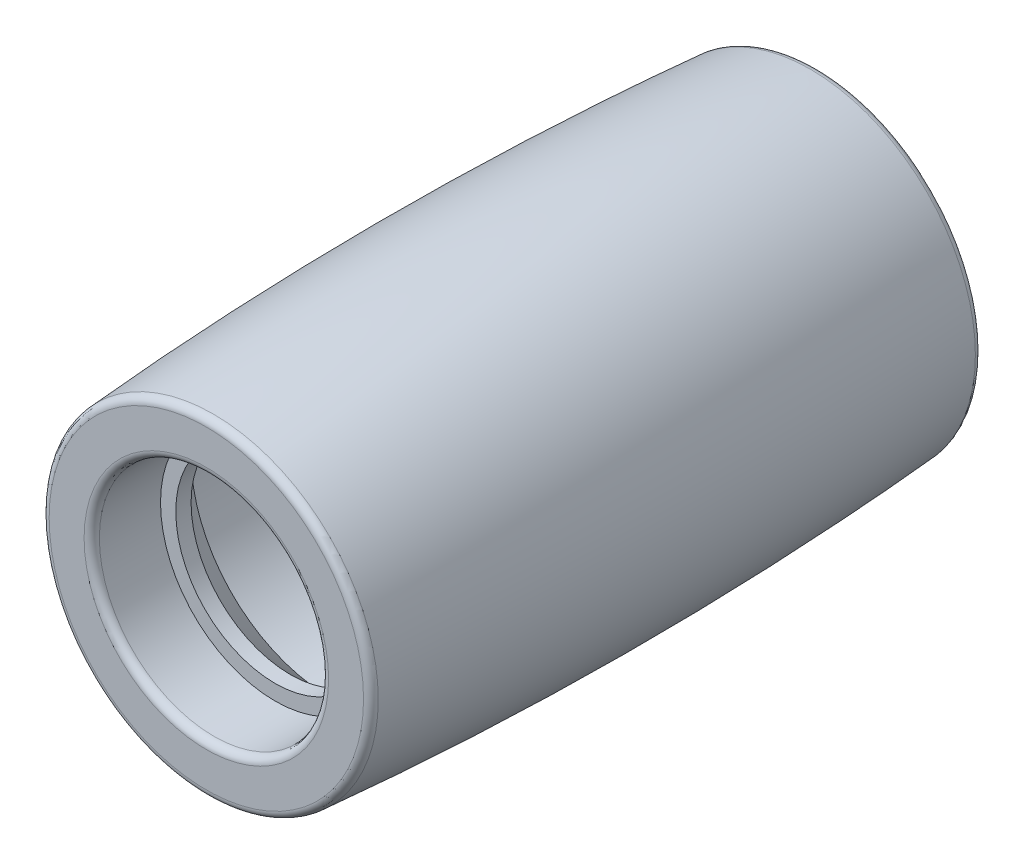
from build123d import *

# Parameters (mm, degrees)
KREISMUSTER2_COUNT = 4
VERRUNDUNG1_R      = 1


with BuildPart() as part:
    # Skizze1 → Rotation1 (revolve)
    with BuildSketch(Plane(origin=(0, 0, 0), x_dir=(0, 0, -1), z_dir=(1, 0, 0))):
        with BuildLine():
            Line((89.5, 21.5), (89.5, 19.25))
            Line((89.5, 19.25), (83.144506921, 19.25))
            Line((83.144506921, 19.25), (81, 18.25))
            Line((81, 18.25), (42.3, 18.25))
            Line((42.3, 18.25), (42.3, 11))
            Line((42.3, 11), (39.3, 11))
            Line((39.3, 11), (39.3, 18.25))
            Line((39.3, 18.25), (25.75, 18.25))
            Line((25.75, 18.25), (20.5, 13))
            Line((20.5, 13), (18.5, 13))
            Line((18.5, 13), (18.5, 15))
            Line((18.5, 15), (9.5, 15))
            Line((9.5, 15), (9.5, 21.5))
            ThreePointArc((9.5, 21.5), (49.5, 23), (89.5, 21.5))
        make_face()
    revolve(axis=Axis((0, 0, 0), (0, 0, -1)))

    # Skizze5 → Durchgangsloch für M31 (revolve, cut)
    with BuildSketch(Plane(origin=(0, 14, -39.3), x_dir=(0, -1, 0), z_dir=(1, 0, 0))):
        Polygon((0, 0), (0, 10.581549114), (1.8, 9.5), (1.8, 0), align=None)
    durchgangsloch_f_r_m31 = revolve(axis=Axis((0, 14, -32.95), (0, 0, -1)), mode=Mode.SUBTRACT)

    # Kreismuster2: Durchgangsloch für M31 ×4 about axis
    kreismuster2_axis = Axis((0, 0, 0), (0, 0, 1))
    for i in range(1, KREISMUSTER2_COUNT):
        add(durchgangsloch_f_r_m31.rotate(kreismuster2_axis, i * 360 / KREISMUSTER2_COUNT), mode=Mode.SUBTRACT)

    # Verrundung1
    verrundung1_edges = [part.edges().sort_by_distance(p)[0] for p in [
        (0, -21.5, -89.5),
        (0, -21.5, -9.5),
        (0, -15, -9.5),
    ]]
    fillet(verrundung1_edges, radius=VERRUNDUNG1_R)


solid = part.part
